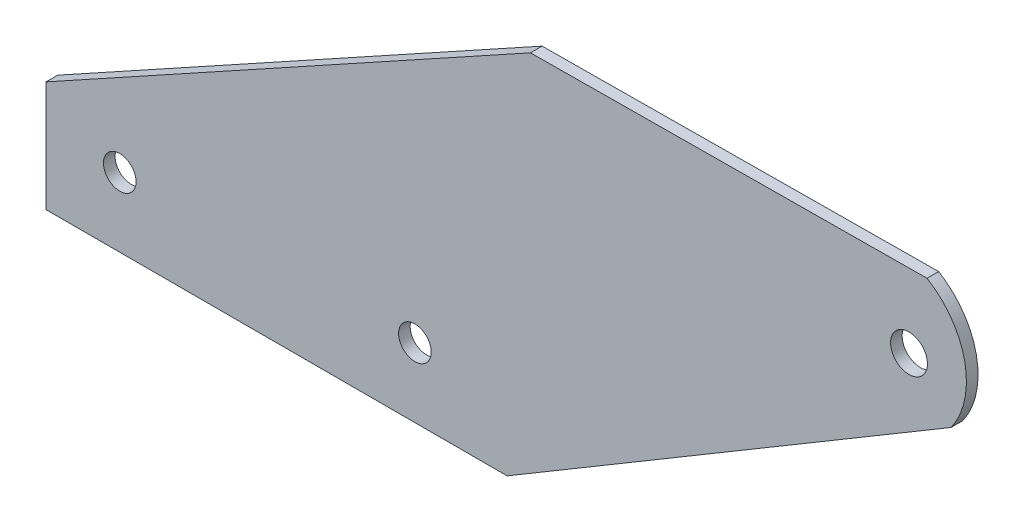
from build123d import *

# Parameters (mm, degrees)
SKETCH1_R           = 2.2479
SKETCH1_R_2         = 2.54
BOSS_EXTRUDE1_DEPTH = 1.6002


with BuildPart() as part:
    # Sketch1 → Boss-Extrude1 (new body)
    with BuildSketch(Plane.XY):
        with BuildLine():
            Line((0, 0), (0, 15.24))
            Line((0, 15.24), (66.713584346, 52.060343069))
            Line((66.713584346, 52.060343069), (121.323584346, 52.482745441))
            ThreePointArc((121.323584346, 52.482745441), (126.52255489, 45.138126941), (124.63483314, 36.339875852))
            Line((124.63483314, 36.339875852), (63.5, 0))
            Line((63.5, 0), (0, 0))
        make_face()
        with Locations((10.16, 9.525)):
            Circle(SKETCH1_R, mode=Mode.SUBTRACT)
        with Locations((50.8, 9.525)):
            Circle(SKETCH1_R, mode=Mode.SUBTRACT)
        with Locations((118.841606936, 42.303243693)):
            Circle(SKETCH1_R_2, mode=Mode.SUBTRACT)
    extrude(amount=-BOSS_EXTRUDE1_DEPTH)


solid = part.part
